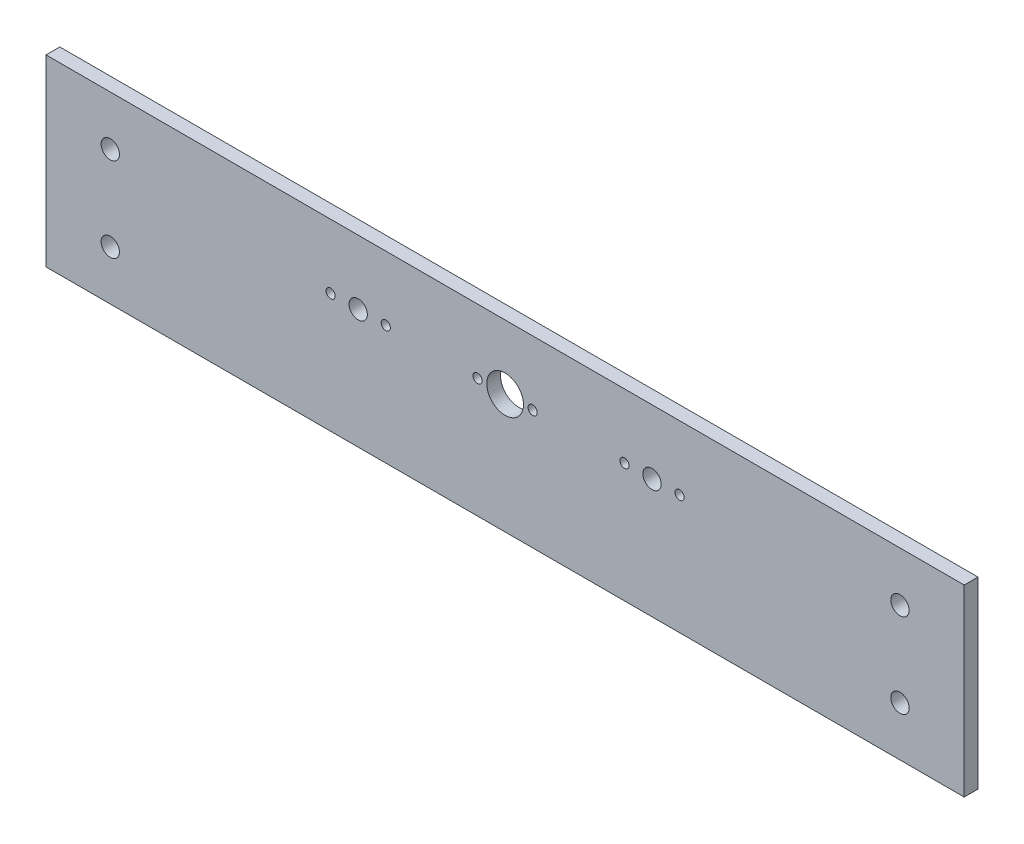
from build123d import *

# Parameters (mm, degrees)
SKETCH2_W           = 500
SKETCH2_H           = 100
BOSS_EXTRUDE1_DEPTH = 7.5
SKETCH9_R           = 5
SKETCH9_R_2         = 2.5
SKETCH9_R_3         = 10
CUT_EXTRUDE3_DEPTH  = 510.957106039
SKETCH11_R          = 5
CUT_EXTRUDE4_DEPTH  = 510.957106039


with BuildPart() as part:
    # Sketch2 → Boss-Extrude1 (new body)
    with BuildSketch(Plane.XY):
        with Locations((250, 50)):
            Rectangle(SKETCH2_W, SKETCH2_H)
    extrude(amount=BOSS_EXTRUDE1_DEPTH)

    # Sketch9 → Cut-Extrude3 (cut, through all)
    with BuildSketch(Plane.XY.offset(7.5)):
        with Locations((170, 65)):
            Circle(SKETCH9_R)
        with Locations((185, 65)):
            Circle(SKETCH9_R_2)
        with Locations((155, 65)):
            Circle(SKETCH9_R_2)
        with Locations((330, 65)):
            Circle(SKETCH9_R)
        with Locations((345, 65)):
            Circle(SKETCH9_R_2)
        with Locations((315, 65)):
            Circle(SKETCH9_R_2)
        with Locations((250, 65)):
            Circle(SKETCH9_R_3)
        with Locations((265, 65)):
            Circle(SKETCH9_R_2)
        with Locations((235, 65)):
            Circle(SKETCH9_R_2)
    extrude(amount=-CUT_EXTRUDE3_DEPTH, mode=Mode.SUBTRACT)

    # Sketch11 → Cut-Extrude4 (cut, through all)
    with BuildSketch(Plane.XY.offset(7.5)):
        with Locations((35, 73)):
            Circle(SKETCH11_R)
        with Locations((35, 27)):
            Circle(SKETCH11_R)
        with Locations((465, 27)):
            Circle(SKETCH11_R)
        with Locations((465, 73)):
            Circle(SKETCH11_R)
    extrude(amount=-CUT_EXTRUDE4_DEPTH, mode=Mode.SUBTRACT)


solid = part.part
